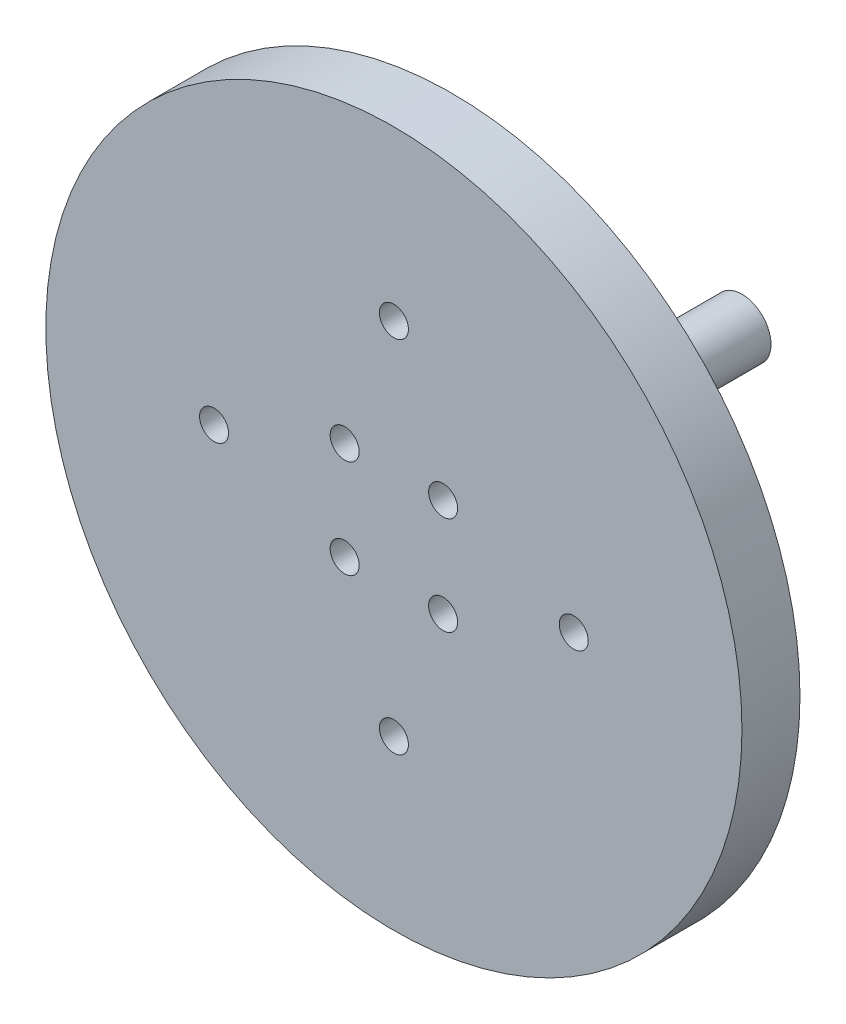
from build123d import *

# Parameters (mm, degrees)
SKETCH1_R           = 30
BOSS_EXTRUDE1_DEPTH = 5
SKETCH2_R           = 1.25
CUT_EXTRUDE1_DEPTH  = 5
SKETCH3_R           = 2.5
BOSS_EXTRUDE2_DEPTH = 25


with BuildPart() as part:
    # Sketch1 → Boss-Extrude1 (new body)
    with BuildSketch(Plane.XY):
        Circle(SKETCH1_R)
    extrude(amount=BOSS_EXTRUDE1_DEPTH)

    # Sketch2 → Cut-Extrude1 (cut)
    with BuildSketch(Plane.XY.offset(5)):
        with Locations((0, 15.5)):
            Circle(SKETCH2_R)
        with Locations((15.5, 0)):
            Circle(SKETCH2_R)
        with Locations((0, -15.5)):
            Circle(SKETCH2_R)
        with Locations((-15.5, 0)):
            Circle(SKETCH2_R)
        with Locations((4.242640687, 4.242640687)):
            Circle(SKETCH2_R)
        with Locations((4.242640687, -4.242640687)):
            Circle(SKETCH2_R)
        with Locations((-4.242640687, -4.242640687)):
            Circle(SKETCH2_R)
        with Locations((-4.242640687, 4.242640687)):
            Circle(SKETCH2_R)
    extrude(amount=-CUT_EXTRUDE1_DEPTH, mode=Mode.SUBTRACT)

    # Sketch3 → Boss-Extrude2 (add)
    with BuildSketch(Plane(origin=(0, 0, 0), x_dir=(-1, 0, 0), z_dir=(0, 0, -1))):
        Circle(SKETCH3_R)
    extrude(amount=BOSS_EXTRUDE2_DEPTH)


solid = part.part
